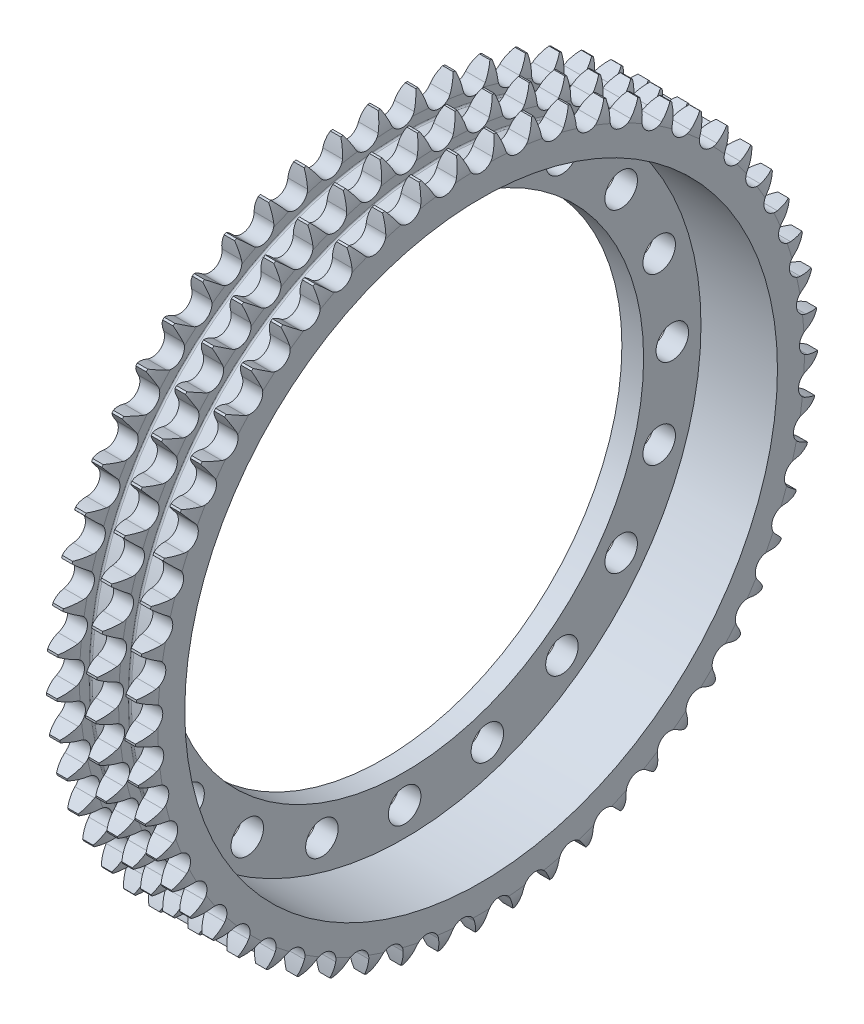
from build123d import *

# Parameters (mm, degrees)
GROOVES_COUNT      = 2
GROOVES_PITCH      = 10.24
TOOTHCUT_DEPTH     = 129.779280038
TEETHCUTS_COUNT    = 57
TEETHCUTS_ANGLE    = 353.684210526
BORSKE_R           = 2
BORE_DEPTH         = 50.0005
SKETCH1_R          = 62.5
SKETCH1_R_2        = 4.25
CUT_EXTRUDE1_DEPTH = 129.760992971
SKETCH3_R          = 77.5
CUT_EXTRUDE5_DEPTH = 20


with BuildPart() as part:
    # BasProSke → Base-Revolve (revolve)
    with BuildSketch(Plane(origin=(0, 0, 0), x_dir=(1, 0, 0), z_dir=(0, 1, 0))):
        with BuildLine():
            Line((0, 0), (0, 84.535209653))
            ThreePointArc((0, 84.535209653), (0.314698702, 86.963372539), (1.238, 89.231086142))
            Line((1.238, 89.231086142), (24.4472, 89.231086142))
            ThreePointArc((24.4472, 89.231086142), (25.370501298, 86.963372539), (25.6852, 84.535209653))
            Line((25.6852, 84.535209653), (25.6852, 0))
            Line((25.6852, 0), (0, 0))
        make_face()
    revolve(axis=Axis((-10, 0, 0), (1, 0, 0)))

    # GrvSke → Groove (revolve, cut)
    with BuildSketch(Plane(origin=(0, 0, 0), x_dir=(1, 0, 0), z_dir=(0, 1, 0))):
        with BuildLine():
            Line((5.2052, 84.535209653), (5.2052, 82.046483741))
            ThreePointArc((5.2052, 82.046483741), (5.322357288, 81.763641029), (5.6052, 81.646483741))
            Line((5.6052, 81.646483741), (9.84, 81.646483741))
            ThreePointArc((9.84, 81.646483741), (10.122842712, 81.763641029), (10.24, 82.046483741))
            Line((10.24, 82.046483741), (10.24, 84.535209653))
            ThreePointArc((10.24, 84.535209653), (10.554698702, 86.963372539), (11.478, 89.231086142))
            Line((11.478, 89.231086142), (3.9672, 89.231086142))
            ThreePointArc((3.9672, 89.231086142), (4.890501298, 86.963372539), (5.2052, 84.535209653))
        make_face()
    groove = revolve(axis=Axis((0, 0, 0), (1, 0, 0)), mode=Mode.SUBTRACT)

    # Grooves: Groove ×2
    with Locations(*[(i * GROOVES_PITCH, 0, 0) for i in range(1, GROOVES_COUNT)]):
        add(groove, mode=Mode.SUBTRACT)

    # TooCutSke → ToothCut (cut, through all)
    with BuildSketch(Plane(origin=(0, 0, 0), x_dir=(0, 0, -1), z_dir=(1, 0, 0))):
        with BuildLine():
            ThreePointArc((2.997961395, 85.346522653), (3.878589944, 87.496887706), (4.869148851, 89.598879511))
            ThreePointArc((4.869148851, 89.598879511), (0, 89.731086142), (-4.869148851, 89.598879511))
            ThreePointArc((-4.869148851, 89.598879511), (-3.878589944, 87.496887706), (-2.997961395, 85.346522653))
            ThreePointArc((-2.997961395, 85.346522653), (0, 83.277961142), (2.997961395, 85.346522653))
        make_face()
    toothcut = extrude(amount=TOOTHCUT_DEPTH, mode=Mode.SUBTRACT)

    # TeethCuts: ToothCut ×57 about axis
    teethcuts_axis = Axis((-10, 0, 0), (1, 0, 0))
    for i in range(1, TEETHCUTS_COUNT):
        add(toothcut.rotate(teethcuts_axis, i * TEETHCUTS_ANGLE / (TEETHCUTS_COUNT - 1)), mode=Mode.SUBTRACT)

    # BorSke → Bore (cut, symmetric)
    with BuildSketch(Plane(origin=(0, 0, 0), x_dir=(0, 0, -1), z_dir=(1, 0, 0))):
        Circle(BORSKE_R)
    extrude(amount=BORE_DEPTH, both=True, mode=Mode.SUBTRACT)

    # Sketch1 → Cut-Extrude1 (cut, through all)
    with BuildSketch(Plane(origin=(25.6852, 0, 0), x_dir=(0, 0, -1), z_dir=(1, 0, 0))):
        Circle(SKETCH1_R)
        with Locations((0, 70)):
            Circle(SKETCH1_R_2)
        with Locations((-66.573956141, 21.631189606)):
            Circle(SKETCH1_R_2)
        with Locations((21.631189606, 66.573956141)):
            Circle(SKETCH1_R_2)
        with Locations((41.14496766, 56.631189606)):
            Circle(SKETCH1_R_2)
        with Locations((56.631189606, 41.14496766)):
            Circle(SKETCH1_R_2)
        with Locations((66.573956141, 21.631189606)):
            Circle(SKETCH1_R_2)
        with Locations((70, 0)):
            Circle(SKETCH1_R_2)
        with Locations((66.573956141, -21.631189606)):
            Circle(SKETCH1_R_2)
        with Locations((56.631189606, -41.14496766)):
            Circle(SKETCH1_R_2)
        with Locations((41.14496766, -56.631189606)):
            Circle(SKETCH1_R_2)
        with Locations((21.631189606, -66.573956141)):
            Circle(SKETCH1_R_2)
        with Locations((0, -70)):
            Circle(SKETCH1_R_2)
        with Locations((-21.631189606, -66.573956141)):
            Circle(SKETCH1_R_2)
        with Locations((-41.14496766, -56.631189606)):
            Circle(SKETCH1_R_2)
        with Locations((-56.631189606, -41.14496766)):
            Circle(SKETCH1_R_2)
        with Locations((-66.573956141, -21.631189606)):
            Circle(SKETCH1_R_2)
        with Locations((-70, 0)):
            Circle(SKETCH1_R_2)
        with Locations((-56.631189606, 41.14496766)):
            Circle(SKETCH1_R_2)
        with Locations((-41.14496766, 56.631189606)):
            Circle(SKETCH1_R_2)
        with Locations((-21.631189606, 66.573956141)):
            Circle(SKETCH1_R_2)
    extrude(amount=-CUT_EXTRUDE1_DEPTH, mode=Mode.SUBTRACT)

    # Sketch3 → Cut-Extrude5 (cut)
    with BuildSketch(Plane(origin=(25.6852, 0, 0), x_dir=(0, 0, -1), z_dir=(1, 0, 0))):
        Circle(SKETCH3_R)
    extrude(amount=-CUT_EXTRUDE5_DEPTH, mode=Mode.SUBTRACT)


solid = part.part
